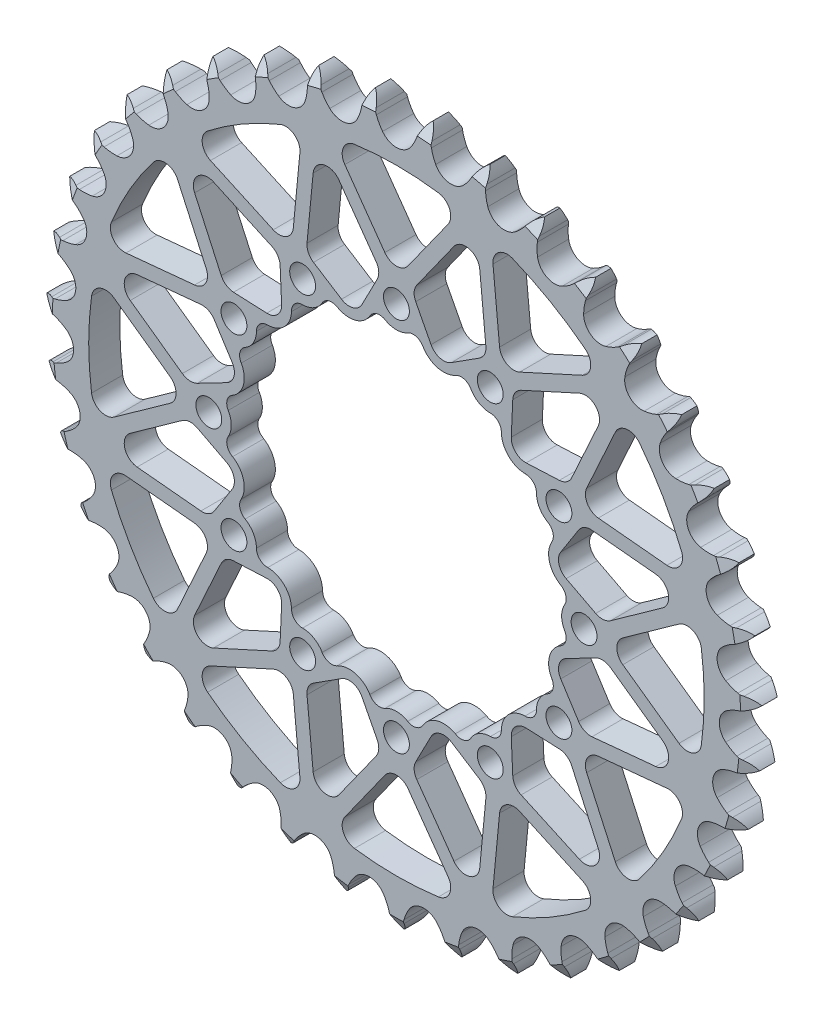
from build123d import *

# Parameters (mm, degrees)
EXTRUSION_DEPTH          = 7.2136
CUT_EXTRUDE_DEPTH        = 118.514389318
CUT_EXTRUDE_DEPTH_BACK   = 118.514389318
SKETCH1_R                = 35.764294032
F_6_0MM_DOWEL_HOLE1_D    = 6
CIRPATTERN1_COUNT        = 12
CUT_EXTRUDE2_DEPTH       = 118.514389318
FILLET2_R                = 3.302
CIRPATTERN3_COUNT        = 12
FILLET2_OF_CIRPATTERN3_R = 3.302
SKETCH14_R               = 35.764294032
CUT_EXTRUDE7_DEPTH       = 118.514389318


with BuildPart() as part:
    # Teeth Sketch → Extrusion (new body)
    with BuildSketch(Plane.XY):
        with BuildLine():
            ThreePointArc((6.676484762, 82.703103732), (5.710873677, 81.555589606), (5.037571935, 80.215493266))
            Line((5.037571935, 80.215493266), (4.65053543, 79.150636707))
            ThreePointArc((4.65053543, 79.150636707), (4.030589042, 77.787636082), (3.22092759, 76.5280518))
            ThreePointArc((3.22092759, 76.5280518), (0, 74.905926143), (-3.22092759, 76.5280518))
            ThreePointArc((-3.22092759, 76.5280518), (-4.030589042, 77.787636082), (-4.65053543, 79.150636707))
            Line((-4.65053543, 79.150636707), (-5.037571935, 80.215493266))
            ThreePointArc((-5.037571935, 80.215493266), (-5.710873677, 81.555589606), (-6.676484762, 82.703103732))
            ThreePointArc((-6.676484762, 82.703103732), (-7.445517227, 81.415554702), (-7.895133318, 79.984807062))
            Line((-7.895133318, 79.984807062), (-8.106342797, 78.871655094))
            ThreePointArc((-8.106342797, 78.871655094), (-8.499620367, 77.426858575), (-9.096745387, 76.053706749))
            ThreePointArc((-9.096745387, 76.053706749), (-12.015755556, 73.935914073), (-15.455180235, 75.020360508))
            ThreePointArc((-15.455180235, 75.020360508), (-16.456408311, 76.133754674), (-17.286967233, 77.379658404))
            Line((-17.286967233, 77.379658404), (-17.83980672, 78.368640329))
            ThreePointArc((-17.83980672, 78.368640329), (-18.719355953, 79.583377579), (-19.856536839, 80.561136787))
            ThreePointArc((-19.856536839, 80.561136787), (-20.409073146, 79.166899696), (-20.623358765, 77.682556369))
            Line((-20.623358765, 77.682556369), (-20.653271004, 76.549939044))
            ThreePointArc((-20.653271004, 76.549939044), (-20.809694072, 75.060766102), (-21.178817437, 73.609610642))
            ThreePointArc((-21.178817437, 73.609610642), (-23.720309356, 71.051000665), (-27.289151829, 71.569681286))
            ThreePointArc((-27.289151829, 71.569681286), (-28.456015249, 72.508049011), (-29.475675664, 73.604587595))
            Line((-29.475675664, 73.604587595), (-30.179999883, 74.492080773))
            ThreePointArc((-30.179999883, 74.492080773), (-31.243016742, 75.549997876), (-32.522315041, 76.332678717))
            ThreePointArc((-32.522315041, 76.332678717), (-32.844044791, 74.867863573), (-32.817450053, 73.368368272))
            Line((-32.817450053, 73.368368272), (-32.66529034, 72.245619783))
            ThreePointArc((-32.66529034, 72.245619783), (-32.580807632, 70.750639215), (-32.71236924, 69.259064285))
            ThreePointArc((-32.71236924, 69.259064285), (-34.810519602, 66.325903661), (-38.416348726, 66.265384911))
            ThreePointArc((-38.416348726, 66.265384911), (-39.71862634, 67.004422965), (-40.900979579, 67.923196629))
            Line((-40.900979579, 67.923196629), (-41.738546902, 68.686215454))
            ThreePointArc((-41.738546902, 68.686215454), (-42.957499809, 69.559912912), (-44.345782367, 70.127244363))
            ThreePointArc((-44.345782367, 70.127244363), (-44.428372928, 68.629789109), (-44.161586623, 67.153977974))
            Line((-44.161586623, 67.153977974), (-43.831295815, 66.070176918))
            ThreePointArc((-43.831295815, 66.070176918), (-43.508095388, 64.608107935), (-43.398687863, 63.114744543))
            ThreePointArc((-43.398687863, 63.114744543), (-44.999155676, 59.883000591), (-48.54858237, 59.244849876))
            ThreePointArc((-48.54858237, 59.244849876), (-49.952545871, 59.765417561), (-51.266969607, 60.48263055))
            Line((-51.266969607, 60.48263055), (-52.21608748, 61.101413234))
            ThreePointArc((-52.21608748, 61.101413234), (-53.559406195, 61.768262742), (-55.020717224, 62.105551216))
            ThreePointArc((-55.020717224, 62.105551216), (-54.862029543, 60.614239157), (-54.361961296, 59.200334922))
            Line((-54.361961296, 59.200334922), (-53.862093752, 58.183551176))
            ThreePointArc((-53.862093752, 58.183551176), (-53.308546327, 56.792260597), (-52.961003266, 55.335786069))
            ThreePointArc((-52.961003266, 55.335786069), (-54.022337255, 51.889159262), (-57.423433231, 50.689904348))
            ThreePointArc((-57.423433231, 50.689904348), (-58.892720703, 50.978519235), (-60.305172051, 51.475596109))
            Line((-60.305172051, 51.475596109), (-61.34125882, 51.934116506))
            ThreePointArc((-61.34125882, 51.934116506), (-62.774152094, 52.376847013), (-64.270644405, 52.475356916))
            ThreePointArc((-64.270644405, 52.475356916), (-63.87478841, 51.02881225), (-63.154389727, 49.713434291))
            Line((-63.154389727, 49.713434291), (-62.497891753, 48.790002021))
            ThreePointArc((-62.497891753, 48.790002021), (-61.728333918, 47.505523541), (-61.151656504, 46.123659804))
            ThreePointArc((-61.151656504, 46.123659804), (-61.646368676, 42.551415963), (-64.811047336, 40.822116924))
            ThreePointArc((-64.811047336, 40.822116924), (-66.307605004, 40.871304038), (-67.781502216, 41.135370767))
            Line((-67.781502216, 41.135370767), (-68.877723777, 41.42175344))
            ThreePointArc((-68.877723777, 41.42175344), (-70.363080428, 41.628898458), (-71.855995657, 41.486078435))
            ThreePointArc((-71.855995657, 41.486078435), (-71.23322381, 40.12176591), (-70.311152637, 38.938981826))
            Line((-70.311152637, 38.938981826), (-69.515027187, 38.132817442))
            ThreePointArc((-69.515027187, 38.132817442), (-68.549390085, 36.988418379), (-67.75851396, 35.716954977))
            ThreePointArc((-67.75851396, 35.716954977), (-67.673791529, 32.111613343), (-70.520089358, 29.897058114))
            ThreePointArc((-70.520089358, 29.897058114), (-72.005157166, 29.705543536), (-73.502327078, 29.729760931))
            Line((-73.502327078, 29.729760931), (-74.630291869, 29.836588719))
            ThreePointArc((-74.630291869, 29.836588719), (-76.129641939, 29.8027833), (-77.580314364, 29.422332315))
            ThreePointArc((-77.580314364, 29.422332315), (-76.74675613, 28.175586908), (-75.646893627, 27.156030185))
            Line((-75.646893627, 27.156030185), (-74.731759931, 26.488012922))
            ThreePointArc((-74.731759931, 26.488012922), (-73.595053056, 25.51333261), (-72.610461496, 24.385199777))
            ThreePointArc((-72.610461496, 24.385199777), (-71.948498729, 20.840136804), (-74.402698108, 18.197681204))
            ThreePointArc((-74.402698108, 18.197681204), (-75.837813579, 17.77042506), (-77.319480277, 17.554165902))
            Line((-77.319480277, 17.554165902), (-78.449974603, 17.478672021))
            ThreePointArc((-78.449974603, 17.478672021), (-79.924485713, 17.204791709), (-81.295343681, 16.596563242))
            ThreePointArc((-81.295343681, 16.596563242), (-80.27258778, 15.499675005), (-79.023419807, 14.669751627))
            Line((-79.023419807, 14.669751627), (-78.012979347, 14.15718278))
            ThreePointArc((-78.012979347, 14.15718278), (-76.734642811, 13.377464928), (-75.58183622, 12.421880712))
            ThreePointArc((-75.58183622, 12.421880712), (-74.359777605, 9.028911669), (-76.358316059, 6.026993909))
            ThreePointArc((-76.358316059, 6.026993909), (-77.706310456, 5.375061909), (-79.134099551, 4.923927198))
            Line((-79.134099551, 4.923927198), (-80.237844202, 4.6680669))
            ThreePointArc((-80.237844202, 4.6680669), (-81.649327289, 4.161205049), (-82.904866299, 3.340951899))
            ThreePointArc((-82.904866299, 3.340951899), (-81.719401571, 2.422329661), (-80.353280924, 1.803534207))
            Line((-80.353280924, 1.803534207), (-79.273703577, 1.45968904))
            ThreePointArc((-79.273703577, 1.45968904), (-77.886845624, 0.895127931), (-76.595681088, 0.136841462))
            ThreePointArc((-76.595681088, 0.136841462), (-74.8451773, -3.016157536), (-76.336293733, -6.299789363))
            ThreePointArc((-76.336293733, -6.299789363), (-77.56225471, -7.159512522), (-78.899187214, -7.833838635))
            Line((-78.899187214, -7.833838635), (-79.947595784, -8.263438702))
            ThreePointArc((-79.947595784, -8.263438702), (-81.259494176, -8.990154635), (-82.367196428, -10.001188343))
            ThreePointArc((-82.367196428, -10.001188343), (-81.049725787, -10.717752749), (-79.602034272, -11.109393802))
            Line((-79.602034272, -11.109393802), (-78.481280524, -11.275609878))
            ThreePointArc((-78.481280524, -11.275609878), (-77.021820047, -11.610392409), (-75.625738049, -12.151741911))
            ThreePointArc((-75.625738049, -12.151741911), (-73.392126218, -14.983109845), (-74.337201497, -18.463411399))
            ThreePointArc((-74.337201497, -18.463411399), (-75.409377308, -19.50865934), (-76.620827372, -20.388712162))
            Line((-76.620827372, -20.388712162), (-77.586746629, -20.980925582))
            ThreePointArc((-77.586746629, -20.980925582), (-78.765082849, -21.908674036), (-79.696259435, -23.08430306))
            ThreePointArc((-79.696259435, -23.08430306), (-78.280904679, -23.580250992), (-76.789136745, -23.734594346))
            Line((-76.789136745, -23.734594346), (-75.656233531, -23.718876424))
            ThreePointArc((-75.656233531, -23.718876424), (-74.161969788, -23.815209685), (-72.697128119, -24.125601551))
            ThreePointArc((-72.697128119, -24.125601551), (-70.038257617, -26.562007479), (-70.41281479, -30.148840778))
            ThreePointArc((-70.41281479, -30.148840778), (-71.303436645, -31.352542128), (-72.358028349, -32.415528753))
            Line((-72.358028349, -32.415528753), (-73.216441492, -33.155017511))
            ThreePointArc((-73.216441492, -33.155017511), (-74.230697248, -34.259770288), (-74.961231185, -35.569546454))
            ThreePointArc((-74.961231185, -35.569546454), (-73.484649258, -35.832033121), (-71.987440912, -35.745081364))
            Line((-71.987440912, -35.745081364), (-70.871729829, -35.547836529))
            ThreePointArc((-70.871729829, -35.547836529), (-69.381363468, -35.403225539), (-67.885700756, -35.474620783))
            ThreePointArc((-67.885700756, -35.474620783), (-64.870434934, -37.452963072), (-64.664773166, -41.053431017))
            ThreePointArc((-64.664773166, -41.053431017), (-65.350774426, -42.384410543), (-66.221194398, -43.602800177))
            Line((-66.221194398, -43.602800177), (-66.949868978, -44.470411902))
            ThreePointArc((-66.949868978, -44.470411902), (-67.773775581, -45.723556485), (-68.284746423, -47.133557278))
            ThreePointArc((-68.284746423, -47.133557278), (-66.785180021, -47.155784414), (-65.321308173, -46.829789551))
            Line((-65.321308173, -46.829789551), (-64.251685552, -46.456126341))
            ThreePointArc((-64.251685552, -46.456126341), (-62.803816278, -46.074316448), (-61.316069403, -45.904865971))
            ThreePointArc((-61.316069403, -45.904865971), (-58.022502061, -47.373906594), (-57.241947884, -50.894758957))
            ThreePointArc((-57.241947884, -50.894758957), (-57.705561477, -52.318544989), (-58.369266298, -53.66078198))
            Line((-58.369266298, -53.66078198), (-58.949330025, -54.634045983))
            ThreePointArc((-58.949330025, -54.634045983), (-59.561548726, -56.003126587), (-59.839722596, -57.476833727))
            ThreePointArc((-59.839722596, -57.476833727), (-58.356009703, -57.25822566), (-56.963387864, -56.701630787))
            Line((-56.963387864, -56.701630787), (-55.967556369, -56.161226883))
            ThreePointArc((-55.967556369, -56.161226883), (-54.599683236, -55.552106762), (-53.15838406, -55.146199243))
            ThreePointArc((-53.15838406, -55.146199243), (-49.671816862, -56.06789082), (-48.336586219, -59.417939375))
            ThreePointArc((-48.336586219, -59.417939375), (-48.565804798, -60.897656602), (-49.00560486, -62.328977716))
            Line((-49.00560486, -62.328977716), (-49.422034389, -63.382686971))
            ThreePointArc((-49.422034389, -63.382686971), (-49.806709045, -64.832245127), (-49.844881387, -66.331490374))
            ThreePointArc((-49.844881387, -66.331490374), (-48.415449386, -65.877708938), (-47.130145731, -65.104929569))
            Line((-47.130145731, -65.104929569), (-46.233896874, -64.411781148))
            ThreePointArc((-46.233896874, -64.411781148), (-44.981447078, -63.591126692), (-43.623924493, -62.959274922))
            ThreePointArc((-43.623924493, -62.959274922), (-40.034657698, -63.309746125), (-38.179332362, -66.402226373))
            ThreePointArc((-38.179332362, -66.402226373), (-38.168219284, -67.899550896), (-38.372723998, -69.38288567))
            Line((-38.372723998, -69.38288567), (-38.614734022, -70.489749661))
            ThreePointArc((-38.614734022, -70.489749661), (-38.761901763, -71.982242573), (-38.559083932, -73.468196262))
            ThreePointArc((-38.559083932, -73.468196262), (-37.220954361, -72.790994159), (-36.076257579, -71.822044874))
            Line((-36.076257579, -71.822044874), (-35.302803736, -70.994104116))
            ThreePointArc((-35.302803736, -70.994104116), (-34.198215068, -69.983169844), (-32.959628196, -69.141738451))
            ThreePointArc((-32.959628196, -69.141738451), (-29.360621929, -68.91191226), (-27.033253851, -71.666730588))
            ThreePointArc((-27.033253851, -71.666730588), (-26.78209694, -73.142882488), (-26.74600974, -74.639813329))
            Line((-26.74600974, -74.639813329), (-26.807332328, -75.77116486))
            ThreePointArc((-26.807332328, -75.77116486), (-26.713181585, -77.267937748), (-26.274626458, -78.702114459))
            ThreePointArc((-26.274626458, -78.702114459), (-25.06245617, -77.819030866), (-24.088013307, -76.679006943))
            Line((-24.088013307, -76.679006943), (-23.457386525, -75.737717079))
            ThreePointArc((-23.457386525, -75.737717079), (-22.529267252, -74.562685657), (-21.441694841, -73.533467273))
            ThreePointArc((-21.441694841, -73.533467273), (-17.926161474, -72.729296065), (-15.187028265, -75.075104125))
            ThreePointArc((-15.187028265, -75.075104125), (-14.702332353, -76.491851845), (-14.426587879, -77.96360903))
            Line((-14.426587879, -77.96360903), (-14.305634807, -79.090146691))
            ThreePointArc((-14.305634807, -79.090146691), (-13.972604036, -80.552433921), (-13.309669959, -81.897689231))
            ThreePointArc((-13.309669959, -81.897689231), (-12.254853529, -80.83159555), (-11.475902142, -79.55002301))
            Line((-11.475902142, -79.55002301), (-11.004435324, -78.519762952))
            ThreePointArc((-11.004435324, -78.519762952), (-10.276823247, -77.211067077), (-9.368432854, -76.020717918))
            ThreePointArc((-9.368432854, -76.020717918), (-6.027422853, -74.663029306), (-2.947466624, -76.5390719))
            ThreePointArc((-2.947466624, -76.5390719), (-2.241785081, -77.859722417), (-1.733524971, -79.26818821))
            Line((-1.733524971, -79.26818821), (-1.43342886, -80.360735266))
            ThreePointArc((-1.43342886, -80.360735266), (-0.870143382, -81.750664368), (0, -82.97215687))
            ThreePointArc((0, -82.97215687), (0.870143382, -81.750664368), (1.43342886, -80.360735266))
            Line((1.43342886, -80.360735266), (1.733524971, -79.26818821))
            ThreePointArc((1.733524971, -79.26818821), (2.241785081, -77.859722417), (2.947466624, -76.5390719))
            ThreePointArc((2.947466624, -76.5390719), (6.027422853, -74.663029306), (9.368432854, -76.020717918))
            ThreePointArc((9.368432854, -76.020717918), (10.276823247, -77.211067077), (11.004435324, -78.519762952))
            Line((11.004435324, -78.519762952), (11.475902142, -79.55002301))
            ThreePointArc((11.475902142, -79.55002301), (12.254853529, -80.83159555), (13.309669959, -81.897689231))
            ThreePointArc((13.309669959, -81.897689231), (13.972604036, -80.552433921), (14.305634807, -79.090146691))
            Line((14.305634807, -79.090146691), (14.426587879, -77.96360903))
            ThreePointArc((14.426587879, -77.96360903), (14.702332353, -76.491851845), (15.187028265, -75.075104125))
            ThreePointArc((15.187028265, -75.075104125), (17.926161474, -72.729296065), (21.441694841, -73.533467273))
            ThreePointArc((21.441694841, -73.533467273), (22.529267252, -74.562685657), (23.457386525, -75.737717079))
            Line((23.457386525, -75.737717079), (24.088013307, -76.679006943))
            ThreePointArc((24.088013307, -76.679006943), (25.06245617, -77.819030866), (26.274626458, -78.702114459))
            ThreePointArc((26.274626458, -78.702114459), (26.713181585, -77.267937748), (26.807332328, -75.77116486))
            Line((26.807332328, -75.77116486), (26.74600974, -74.639813329))
            ThreePointArc((26.74600974, -74.639813329), (26.78209694, -73.142882488), (27.033253851, -71.666730588))
            ThreePointArc((27.033253851, -71.666730588), (29.360621929, -68.91191226), (32.959628196, -69.141738451))
            ThreePointArc((32.959628196, -69.141738451), (34.198215068, -69.983169844), (35.302803736, -70.994104116))
            Line((35.302803736, -70.994104116), (36.076257579, -71.822044874))
            ThreePointArc((36.076257579, -71.822044874), (37.220954361, -72.790994159), (38.559083932, -73.468196262))
            ThreePointArc((38.559083932, -73.468196262), (38.761901763, -71.982242573), (38.614734022, -70.489749661))
            Line((38.614734022, -70.489749661), (38.372723998, -69.38288567))
            ThreePointArc((38.372723998, -69.38288567), (38.168219284, -67.899550896), (38.179332362, -66.402226373))
            ThreePointArc((38.179332362, -66.402226373), (40.034657698, -63.309746125), (43.623924493, -62.959274922))
            ThreePointArc((43.623924493, -62.959274922), (44.981447078, -63.591126692), (46.233896874, -64.411781148))
            Line((46.233896874, -64.411781148), (47.130145731, -65.104929569))
            ThreePointArc((47.130145731, -65.104929569), (48.415449386, -65.877708938), (49.844881387, -66.331490374))
            ThreePointArc((49.844881387, -66.331490374), (49.806709045, -64.832245127), (49.422034389, -63.382686971))
            Line((49.422034389, -63.382686971), (49.00560486, -62.328977716))
            ThreePointArc((49.00560486, -62.328977716), (48.565804798, -60.897656602), (48.336586219, -59.417939375))
            ThreePointArc((48.336586219, -59.417939375), (49.671816862, -56.06789082), (53.15838406, -55.146199243))
            ThreePointArc((53.15838406, -55.146199243), (54.599683236, -55.552106762), (55.967556369, -56.161226883))
            Line((55.967556369, -56.161226883), (56.963387864, -56.701630787))
            ThreePointArc((56.963387864, -56.701630787), (58.356009703, -57.25822566), (59.839722596, -57.476833727))
            ThreePointArc((59.839722596, -57.476833727), (59.561548726, -56.003126587), (58.949330025, -54.634045983))
            Line((58.949330025, -54.634045983), (58.369266298, -53.66078198))
            ThreePointArc((58.369266298, -53.66078198), (57.705561477, -52.318544989), (57.241947884, -50.894758957))
            ThreePointArc((57.241947884, -50.894758957), (58.022502061, -47.373906594), (61.316069403, -45.904865971))
            ThreePointArc((61.316069403, -45.904865971), (62.803816278, -46.074316448), (64.251685552, -46.456126341))
            Line((64.251685552, -46.456126341), (65.321308173, -46.829789551))
            ThreePointArc((65.321308173, -46.829789551), (66.785180021, -47.155784414), (68.284746423, -47.133557278))
            ThreePointArc((68.284746423, -47.133557278), (67.773775581, -45.723556485), (66.949868978, -44.470411902))
            Line((66.949868978, -44.470411902), (66.221194398, -43.602800177))
            ThreePointArc((66.221194398, -43.602800177), (65.350774426, -42.384410543), (64.664773166, -41.053431017))
            ThreePointArc((64.664773166, -41.053431017), (64.870434934, -37.452963072), (67.885700756, -35.474620783))
            ThreePointArc((67.885700756, -35.474620783), (69.381363468, -35.403225539), (70.871729829, -35.547836529))
            Line((70.871729829, -35.547836529), (71.987440912, -35.745081364))
            ThreePointArc((71.987440912, -35.745081364), (73.484649258, -35.832033121), (74.961231185, -35.569546454))
            ThreePointArc((74.961231185, -35.569546454), (74.230697248, -34.259770288), (73.216441492, -33.155017511))
            Line((73.216441492, -33.155017511), (72.358028349, -32.415528753))
            ThreePointArc((72.358028349, -32.415528753), (71.303436645, -31.352542128), (70.41281479, -30.148840778))
            ThreePointArc((70.41281479, -30.148840778), (70.038257617, -26.562007479), (72.697128119, -24.125601551))
            ThreePointArc((72.697128119, -24.125601551), (74.161969788, -23.815209685), (75.656233531, -23.718876424))
            Line((75.656233531, -23.718876424), (76.789136745, -23.734594346))
            ThreePointArc((76.789136745, -23.734594346), (78.280904679, -23.580250992), (79.696259435, -23.08430306))
            ThreePointArc((79.696259435, -23.08430306), (78.765082849, -21.908674036), (77.586746629, -20.980925582))
            Line((77.586746629, -20.980925582), (76.620827372, -20.388712162))
            ThreePointArc((76.620827372, -20.388712162), (75.409377308, -19.50865934), (74.337201497, -18.463411399))
            ThreePointArc((74.337201497, -18.463411399), (73.392126218, -14.983109845), (75.625738049, -12.151741911))
            ThreePointArc((75.625738049, -12.151741911), (77.021820047, -11.610392409), (78.481280524, -11.275609878))
            Line((78.481280524, -11.275609878), (79.602034272, -11.109393802))
            ThreePointArc((79.602034272, -11.109393802), (81.049725787, -10.717752749), (82.367196428, -10.001188343))
            ThreePointArc((82.367196428, -10.001188343), (81.259494176, -8.990154635), (79.947595784, -8.263438702))
            Line((79.947595784, -8.263438702), (78.899187214, -7.833838635))
            ThreePointArc((78.899187214, -7.833838635), (77.56225471, -7.159512522), (76.336293733, -6.299789363))
            ThreePointArc((76.336293733, -6.299789363), (74.8451773, -3.016157536), (76.595681088, 0.136841462))
            ThreePointArc((76.595681088, 0.136841462), (77.886845624, 0.895127931), (79.273703577, 1.45968904))
            Line((79.273703577, 1.45968904), (80.353280924, 1.803534207))
            ThreePointArc((80.353280924, 1.803534207), (81.719401571, 2.422329661), (82.904866299, 3.340951899))
            ThreePointArc((82.904866299, 3.340951899), (81.649327289, 4.161205049), (80.237844202, 4.6680669))
            Line((80.237844202, 4.6680669), (79.134099551, 4.923927198))
            ThreePointArc((79.134099551, 4.923927198), (77.706310456, 5.375061909), (76.358316059, 6.026993909))
            ThreePointArc((76.358316059, 6.026993909), (74.359777605, 9.028911669), (75.58183622, 12.421880712))
            ThreePointArc((75.58183622, 12.421880712), (76.734642811, 13.377464928), (78.012979347, 14.15718278))
            Line((78.012979347, 14.15718278), (79.023419807, 14.669751627))
            ThreePointArc((79.023419807, 14.669751627), (80.27258778, 15.499675005), (81.295343681, 16.596563242))
            ThreePointArc((81.295343681, 16.596563242), (79.924485713, 17.204791709), (78.449974603, 17.478672021))
            Line((78.449974603, 17.478672021), (77.319480277, 17.554165902))
            ThreePointArc((77.319480277, 17.554165902), (75.837813579, 17.77042506), (74.402698108, 18.197681204))
            ThreePointArc((74.402698108, 18.197681204), (71.948498729, 20.840136804), (72.610461496, 24.385199777))
            ThreePointArc((72.610461496, 24.385199777), (73.595053056, 25.51333261), (74.731759931, 26.488012922))
            Line((74.731759931, 26.488012922), (75.646893627, 27.156030185))
            ThreePointArc((75.646893627, 27.156030185), (76.74675613, 28.175586908), (77.580314364, 29.422332315))
            ThreePointArc((77.580314364, 29.422332315), (76.129641939, 29.8027833), (74.630291869, 29.836588719))
            Line((74.630291869, 29.836588719), (73.502327078, 29.729760931))
            ThreePointArc((73.502327078, 29.729760931), (72.005157166, 29.705543536), (70.520089358, 29.897058114))
            ThreePointArc((70.520089358, 29.897058114), (67.673791529, 32.111613343), (67.75851396, 35.716954977))
            ThreePointArc((67.75851396, 35.716954977), (68.549390085, 36.988418379), (69.515027187, 38.132817442))
            Line((69.515027187, 38.132817442), (70.311152637, 38.938981826))
            ThreePointArc((70.311152637, 38.938981826), (71.23322381, 40.12176591), (71.855995657, 41.486078435))
            ThreePointArc((71.855995657, 41.486078435), (70.363080428, 41.628898458), (68.877723777, 41.42175344))
            Line((68.877723777, 41.42175344), (67.781502216, 41.135370767))
            ThreePointArc((67.781502216, 41.135370767), (66.307605004, 40.871304038), (64.811047336, 40.822116924))
            ThreePointArc((64.811047336, 40.822116924), (61.646368676, 42.551415963), (61.151656504, 46.123659804))
            ThreePointArc((61.151656504, 46.123659804), (61.728333918, 47.505523541), (62.497891753, 48.790002021))
            Line((62.497891753, 48.790002021), (63.154389727, 49.713434291))
            ThreePointArc((63.154389727, 49.713434291), (63.87478841, 51.02881225), (64.270644405, 52.475356916))
            ThreePointArc((64.270644405, 52.475356916), (62.774152094, 52.376847013), (61.34125882, 51.934116506))
            Line((61.34125882, 51.934116506), (60.305172051, 51.475596109))
            ThreePointArc((60.305172051, 51.475596109), (58.892720703, 50.978519235), (57.423433231, 50.689904348))
            ThreePointArc((57.423433231, 50.689904348), (54.022337255, 51.889159262), (52.961003266, 55.335786069))
            ThreePointArc((52.961003266, 55.335786069), (53.308546327, 56.792260597), (53.862093752, 58.183551176))
            Line((53.862093752, 58.183551176), (54.361961296, 59.200334922))
            ThreePointArc((54.361961296, 59.200334922), (54.862029543, 60.614239157), (55.020717224, 62.105551216))
            ThreePointArc((55.020717224, 62.105551216), (53.559406195, 61.768262742), (52.21608748, 61.101413234))
            Line((52.21608748, 61.101413234), (51.266969607, 60.48263055))
            ThreePointArc((51.266969607, 60.48263055), (49.952545871, 59.765417561), (48.54858237, 59.244849876))
            ThreePointArc((48.54858237, 59.244849876), (44.999155676, 59.883000591), (43.398687863, 63.114744543))
            ThreePointArc((43.398687863, 63.114744543), (43.508095388, 64.608107935), (43.831295815, 66.070176918))
            Line((43.831295815, 66.070176918), (44.161586623, 67.153977974))
            ThreePointArc((44.161586623, 67.153977974), (44.428372928, 68.629789109), (44.345782367, 70.127244363))
            ThreePointArc((44.345782367, 70.127244363), (42.957499809, 69.559912912), (41.738546902, 68.686215454))
            Line((41.738546902, 68.686215454), (40.900979579, 67.923196629))
            ThreePointArc((40.900979579, 67.923196629), (39.71862634, 67.004422965), (38.416348726, 66.265384911))
            ThreePointArc((38.416348726, 66.265384911), (34.810519602, 66.325903661), (32.71236924, 69.259064285))
            ThreePointArc((32.71236924, 69.259064285), (32.580807632, 70.750639215), (32.66529034, 72.245619783))
            Line((32.66529034, 72.245619783), (32.817450053, 73.368368272))
            ThreePointArc((32.817450053, 73.368368272), (32.844044791, 74.867863573), (32.522315041, 76.332678717))
            ThreePointArc((32.522315041, 76.332678717), (31.243016742, 75.549997876), (30.179999883, 74.492080773))
            Line((30.179999883, 74.492080773), (29.475675664, 73.604587595))
            ThreePointArc((29.475675664, 73.604587595), (28.456015249, 72.508049011), (27.289151829, 71.569681286))
            ThreePointArc((27.289151829, 71.569681286), (23.720309356, 71.051000665), (21.178817437, 73.609610642))
            ThreePointArc((21.178817437, 73.609610642), (20.809694072, 75.060766102), (20.653271004, 76.549939044))
            Line((20.653271004, 76.549939044), (20.623358765, 77.682556369))
            ThreePointArc((20.623358765, 77.682556369), (20.409073146, 79.166899696), (19.856536839, 80.561136787))
            ThreePointArc((19.856536839, 80.561136787), (18.719355953, 79.583377579), (17.83980672, 78.368640329))
            Line((17.83980672, 78.368640329), (17.286967233, 77.379658404))
            ThreePointArc((17.286967233, 77.379658404), (16.456408311, 76.133754674), (15.455180235, 75.020360508))
            ThreePointArc((15.455180235, 75.020360508), (12.015755556, 73.935914073), (9.096745387, 76.053706749))
            ThreePointArc((9.096745387, 76.053706749), (8.499620367, 77.426858575), (8.106342797, 78.871655094))
            Line((8.106342797, 78.871655094), (7.895133318, 79.984807062))
            ThreePointArc((7.895133318, 79.984807062), (7.445517227, 81.415554702), (6.676484762, 82.703103732))
        make_face()
    extrude(amount=EXTRUSION_DEPTH)

    # Sketch1 → Cut-Extrude (cut, two sides: drawn at the far end of the back side and taken through both)
    with BuildSketch(Plane(origin=(0, 0, 0), x_dir=(-1, 0, 0), z_dir=(0, 0, -1)).offset(-CUT_EXTRUDE_DEPTH_BACK)):
        Circle(SKETCH1_R)
    extrude(amount=CUT_EXTRUDE_DEPTH + CUT_EXTRUDE_DEPTH_BACK, mode=Mode.SUBTRACT)

    # Ø6.0mm Dowel Hole1 (through all)
    with Locations(Plane.XY.offset(7.2136)):
        with Locations((-43.500000122, 0)):
            f_6_0mm_dowel_hole1 = Hole(F_6_0MM_DOWEL_HOLE1_D / 2)

    # CirPattern1: Ø6.0mm Dowel Hole1 ×12 about axis
    cirpattern1_axis = Axis((0, 0, 7.2136), (0, 0, -1))
    for i in range(1, CIRPATTERN1_COUNT):
        add(f_6_0mm_dowel_hole1.rotate(cirpattern1_axis, i * 360 / CIRPATTERN1_COUNT), mode=Mode.SUBTRACT)

    # Sketch9 → Cut-Extrude2 (cut, through all)
    with BuildSketch(Plane.XY):
        with BuildLine():
            Line((-48.707000122, 0), (-69.753908506, 15.006805414))
            ThreePointArc((-69.753908506, 15.006805414), (-71.349926143, 0), (-69.753908506, -15.006805414))
            Line((-69.753908506, -15.006805414), (-48.707000122, 0))
        make_face()
        Polygon((-43.325238517, 20.926367996), (-68.918736366, 18.466719753), (-47.983941179, 3.539852965), (-36.140398804, 9.683790674), align=None)
    cut_extrude2 = extrude(amount=CUT_EXTRUDE2_DEPTH, mode=Mode.SUBTRACT)

    # Fillet2
    fillet2_edges = [part.edges().sort_by_distance(p)[0] for p in [
        (-68.918736366, 18.466719753, 3.6068),
        (-36.140398804, 9.683790674, 3.6068),
        (-47.983941179, 3.539852965, 3.6068),
        (-43.325238517, 20.926367996, 3.6068),
        (-69.753908506, -15.006805414, 3.6068),
        (-48.707000122, 0, 3.6068),
        (-69.753908506, 15.006805414, 3.6068),
    ]]
    fillet(fillet2_edges, radius=FILLET2_R)

    # CirPattern3: Cut-Extrude2 ×12 about axis
    cirpattern3_axis = Axis((0, 0, 7.2136), (0, 0, -1))
    for i in range(1, CIRPATTERN3_COUNT):
        add(cut_extrude2.rotate(cirpattern3_axis, i * 360 / CIRPATTERN3_COUNT), mode=Mode.SUBTRACT)

    # Fillet2 of CirPattern3
    fillet2_of_cirpattern3_edges = [part.edges().sort_by_distance(p)[0] for p in [
        (-50.452016613, 50.452016613, 3.6068),
        (-26.45660813, 26.45660813, 3.6068),
        (-39.785385552, 27.057573183, 3.6068),
        (-27.057573183, 39.785385552, 3.6068),
        (-67.912059487, 21.880679535, 3.6068),
        (-42.181499448, 24.353500061, 3.6068),
        (-52.905254073, 47.873228971, 3.6068),
        (-18.466719753, 68.918736366, 3.6068),
        (-9.683790674, 36.140398804, 3.6068),
        (-20.926367996, 43.325238517, 3.6068),
        (-3.539852965, 47.983941179, 3.6068),
        (-47.873228971, 52.905254073, 3.6068),
        (-24.353500061, 42.181499448, 3.6068),
        (-21.880679535, 67.912059487, 3.6068),
        (18.466719753, 68.918736366, 3.6068),
        (9.683790674, 36.140398804, 3.6068),
        (3.539852965, 47.983941179, 3.6068),
        (20.926367996, 43.325238517, 3.6068),
        (-15.006805414, 69.753908506, 3.6068),
        (0, 48.707000122, 3.6068),
        (15.006805414, 69.753908506, 3.6068),
        (50.452016613, 50.452016613, 3.6068),
        (26.45660813, 26.45660813, 3.6068),
        (27.057573183, 39.785385552, 3.6068),
        (39.785385552, 27.057573183, 3.6068),
        (21.880679535, 67.912059487, 3.6068),
        (24.353500061, 42.181499448, 3.6068),
        (47.873228971, 52.905254073, 3.6068),
        (68.918736366, 18.466719753, 3.6068),
        (36.140398804, 9.683790674, 3.6068),
        (43.325238517, 20.926367996, 3.6068),
        (47.983941179, 3.539852965, 3.6068),
        (52.905254073, 47.873228971, 3.6068),
        (42.181499448, 24.353500061, 3.6068),
        (67.912059487, 21.880679535, 3.6068),
        (68.918736366, -18.466719753, 3.6068),
        (36.140398804, -9.683790674, 3.6068),
        (47.983941179, -3.539852965, 3.6068),
        (43.325238517, -20.926367996, 3.6068),
        (69.753908506, 15.006805414, 3.6068),
        (48.707000122, 0, 3.6068),
        (69.753908506, -15.006805414, 3.6068),
        (50.452016613, -50.452016613, 3.6068),
        (26.45660813, -26.45660813, 3.6068),
        (39.785385552, -27.057573183, 3.6068),
        (27.057573183, -39.785385552, 3.6068),
        (67.912059487, -21.880679535, 3.6068),
        (42.181499448, -24.353500061, 3.6068),
        (52.905254073, -47.873228971, 3.6068),
        (18.466719753, -68.918736366, 3.6068),
        (9.683790674, -36.140398804, 3.6068),
        (20.926367996, -43.325238517, 3.6068),
        (3.539852965, -47.983941179, 3.6068),
        (47.873228971, -52.905254073, 3.6068),
        (24.353500061, -42.181499448, 3.6068),
        (21.880679535, -67.912059487, 3.6068),
        (-18.466719753, -68.918736366, 3.6068),
        (-9.683790674, -36.140398804, 3.6068),
        (-3.539852965, -47.983941179, 3.6068),
        (-20.926367996, -43.325238517, 3.6068),
        (15.006805414, -69.753908506, 3.6068),
        (0, -48.707000122, 3.6068),
        (-15.006805414, -69.753908506, 3.6068),
        (-50.452016613, -50.452016613, 3.6068),
        (-26.45660813, -26.45660813, 3.6068),
        (-27.057573183, -39.785385552, 3.6068),
        (-39.785385552, -27.057573183, 3.6068),
        (-21.880679535, -67.912059487, 3.6068),
        (-24.353500061, -42.181499448, 3.6068),
        (-47.873228971, -52.905254073, 3.6068),
        (-68.918736366, -18.466719753, 3.6068),
        (-36.140398804, -9.683790674, 3.6068),
        (-43.325238517, -20.926367996, 3.6068),
        (-47.983941179, -3.539852965, 3.6068),
        (-52.905254073, -47.873228971, 3.6068),
        (-42.181499448, -24.353500061, 3.6068),
        (-67.912059487, -21.880679535, 3.6068),
    ]]
    fillet(fillet2_of_cirpattern3_edges, radius=FILLET2_OF_CIRPATTERN3_R)

    # Sketch14 → Cut-Extrude7 (cut, through all)
    with BuildSketch(Plane.XY.offset(7.2136)):
        with BuildLine():
            Line((-38.295599647, 5.990473358), (-37.976638316, 6.155937244))
            ThreePointArc((-37.976638316, 6.155937244), (-39.24649701, 4.608711867), (-39.001430567, 2.622159599))
            ThreePointArc((-39.001430567, 2.622159599), (-38.293000122, 0), (-39.001430567, -2.622159599))
            ThreePointArc((-39.001430567, -2.622159599), (-39.24649701, -4.608711867), (-37.976638316, -6.155937244))
            Line((-37.976638316, -6.155937244), (-38.295599647, -5.990473358))
            ThreePointArc((-38.295599647, -5.990473358), (-35.471196357, -9.504478418), (-36.160198827, -13.959897715))
            Line((-36.160198827, -13.959897715), (-35.966702154, -13.65712112))
            ThreePointArc((-35.966702154, -13.65712112), (-36.292819354, -15.63198695), (-35.087309455, -17.229858458))
            ThreePointArc((-35.087309455, -17.229858458), (-33.162710893, -19.146500061), (-32.465149856, -21.771572109))
            ThreePointArc((-32.465149856, -21.771572109), (-31.684107487, -23.61451006), (-29.81076491, -24.319517196))
            Line((-29.81076491, -24.319517196), (-30.169725469, -24.335701932))
            ThreePointArc((-30.169725469, -24.335701932), (-25.966717938, -25.966717938), (-24.335701932, -30.169725469))
            Line((-24.335701932, -30.169725469), (-24.319517196, -29.81076491))
            ThreePointArc((-24.319517196, -29.81076491), (-23.61451006, -31.684107487), (-21.771572109, -32.465149856))
            ThreePointArc((-21.771572109, -32.465149856), (-19.146500061, -33.162710893), (-17.229858458, -35.087309455))
            ThreePointArc((-17.229858458, -35.087309455), (-15.63198695, -36.292819354), (-13.65712112, -35.966702154))
            Line((-13.65712112, -35.966702154), (-13.959897715, -36.160198827))
            ThreePointArc((-13.959897715, -36.160198827), (-9.504478418, -35.471196357), (-5.990473358, -38.295599647))
            Line((-5.990473358, -38.295599647), (-6.155937244, -37.976638316))
            ThreePointArc((-6.155937244, -37.976638316), (-4.608711867, -39.24649701), (-2.622159599, -39.001430567))
            ThreePointArc((-2.622159599, -39.001430567), (0, -38.293000122), (2.622159599, -39.001430567))
            ThreePointArc((2.622159599, -39.001430567), (4.608711867, -39.24649701), (6.155937244, -37.976638316))
            Line((6.155937244, -37.976638316), (5.990473358, -38.295599647))
            ThreePointArc((5.990473358, -38.295599647), (9.504478418, -35.471196357), (13.959897715, -36.160198827))
            Line((13.959897715, -36.160198827), (13.65712112, -35.966702154))
            ThreePointArc((13.65712112, -35.966702154), (15.63198695, -36.292819354), (17.229858458, -35.087309455))
            ThreePointArc((17.229858458, -35.087309455), (19.146500061, -33.162710893), (21.771572109, -32.465149856))
            ThreePointArc((21.771572109, -32.465149856), (23.61451006, -31.684107487), (24.319517196, -29.81076491))
            Line((24.319517196, -29.81076491), (24.335701932, -30.169725469))
            ThreePointArc((24.335701932, -30.169725469), (25.966717938, -25.966717938), (30.169725469, -24.335701932))
            Line((30.169725469, -24.335701932), (29.81076491, -24.319517196))
            ThreePointArc((29.81076491, -24.319517196), (31.684107487, -23.61451006), (32.465149856, -21.771572109))
            ThreePointArc((32.465149856, -21.771572109), (33.162710893, -19.146500061), (35.087309455, -17.229858458))
            ThreePointArc((35.087309455, -17.229858458), (36.292819354, -15.63198695), (35.966702154, -13.65712112))
            Line((35.966702154, -13.65712112), (36.160198827, -13.959897715))
            ThreePointArc((36.160198827, -13.959897715), (35.471196357, -9.504478418), (38.295599647, -5.990473358))
            Line((38.295599647, -5.990473358), (37.976638316, -6.155937244))
            ThreePointArc((37.976638316, -6.155937244), (39.24649701, -4.608711867), (39.001430567, -2.622159599))
            ThreePointArc((39.001430567, -2.622159599), (38.293000122, 0), (39.001430567, 2.622159599))
            ThreePointArc((39.001430567, 2.622159599), (39.24649701, 4.608711867), (37.976638316, 6.155937244))
            Line((37.976638316, 6.155937244), (38.295599647, 5.990473358))
            ThreePointArc((38.295599647, 5.990473358), (35.471196357, 9.504478418), (36.160198827, 13.959897715))
            Line((36.160198827, 13.959897715), (35.966702154, 13.65712112))
            ThreePointArc((35.966702154, 13.65712112), (36.292819354, 15.63198695), (35.087309455, 17.229858458))
            ThreePointArc((35.087309455, 17.229858458), (33.162710893, 19.146500061), (32.465149856, 21.771572109))
            ThreePointArc((32.465149856, 21.771572109), (31.684107487, 23.61451006), (29.81076491, 24.319517196))
            Line((29.81076491, 24.319517196), (30.169725469, 24.335701932))
            ThreePointArc((30.169725469, 24.335701932), (25.966717938, 25.966717938), (24.335701932, 30.169725469))
            Line((24.335701932, 30.169725469), (24.319517196, 29.81076491))
            ThreePointArc((24.319517196, 29.81076491), (23.61451006, 31.684107487), (21.771572109, 32.465149856))
            ThreePointArc((21.771572109, 32.465149856), (19.146500061, 33.162710893), (17.229858458, 35.087309455))
            ThreePointArc((17.229858458, 35.087309455), (15.63198695, 36.292819354), (13.65712112, 35.966702154))
            Line((13.65712112, 35.966702154), (13.959897715, 36.160198827))
            ThreePointArc((13.959897715, 36.160198827), (9.504478418, 35.471196357), (5.990473358, 38.295599647))
            Line((5.990473358, 38.295599647), (6.155937244, 37.976638316))
            ThreePointArc((6.155937244, 37.976638316), (4.608711867, 39.24649701), (2.622159599, 39.001430567))
            ThreePointArc((2.622159599, 39.001430567), (0, 38.293000122), (-2.622159599, 39.001430567))
            ThreePointArc((-2.622159599, 39.001430567), (-4.608711867, 39.24649701), (-6.155937244, 37.976638316))
            Line((-6.155937244, 37.976638316), (-5.990473358, 38.295599647))
            ThreePointArc((-5.990473358, 38.295599647), (-9.504478418, 35.471196357), (-13.959897715, 36.160198827))
            Line((-13.959897715, 36.160198827), (-13.65712112, 35.966702154))
            ThreePointArc((-13.65712112, 35.966702154), (-15.63198695, 36.292819354), (-17.229858458, 35.087309455))
            ThreePointArc((-17.229858458, 35.087309455), (-19.146500061, 33.162710893), (-21.771572109, 32.465149856))
            ThreePointArc((-21.771572109, 32.465149856), (-23.61451006, 31.684107487), (-24.319517196, 29.81076491))
            Line((-24.319517196, 29.81076491), (-24.335701932, 30.169725469))
            ThreePointArc((-24.335701932, 30.169725469), (-25.966717938, 25.966717938), (-30.169725469, 24.335701932))
            Line((-30.169725469, 24.335701932), (-29.81076491, 24.319517196))
            ThreePointArc((-29.81076491, 24.319517196), (-31.684107487, 23.61451006), (-32.465149856, 21.771572109))
            ThreePointArc((-32.465149856, 21.771572109), (-33.162710893, 19.146500061), (-35.087309455, 17.229858458))
            ThreePointArc((-35.087309455, 17.229858458), (-36.292819354, 15.63198695), (-35.966702154, 13.65712112))
            Line((-35.966702154, 13.65712112), (-36.160198827, 13.959897715))
            ThreePointArc((-36.160198827, 13.959897715), (-35.471196357, 9.504478418), (-38.295599647, 5.990473358))
        make_face()
        Circle(SKETCH14_R, mode=Mode.SUBTRACT)
    extrude(amount=-CUT_EXTRUDE7_DEPTH, mode=Mode.SUBTRACT)

    # Sketch18 → Cut-Revolve2 (revolve, cut)
    with BuildSketch(Plane(origin=(0, 0, 0), x_dir=(0, 0, -1), z_dir=(1, 0, 0))):
        Polygon((-7.2136, -82.97215687), (-5.3848, -82.97215687), (-7.2136, -79.778574738), align=None)
    cut_revolve2 = revolve(axis=Axis((0, 0, -0.36068), (0, 0, 1)), mode=Mode.SUBTRACT)

    # Mirror1: Cut-Revolve2 across plane
    add(cut_revolve2.mirror(Plane(origin=(0, 0, 3.6068), x_dir=(1, 0, 0), z_dir=(0, 0, -1))), mode=Mode.SUBTRACT)


solid = part.part
